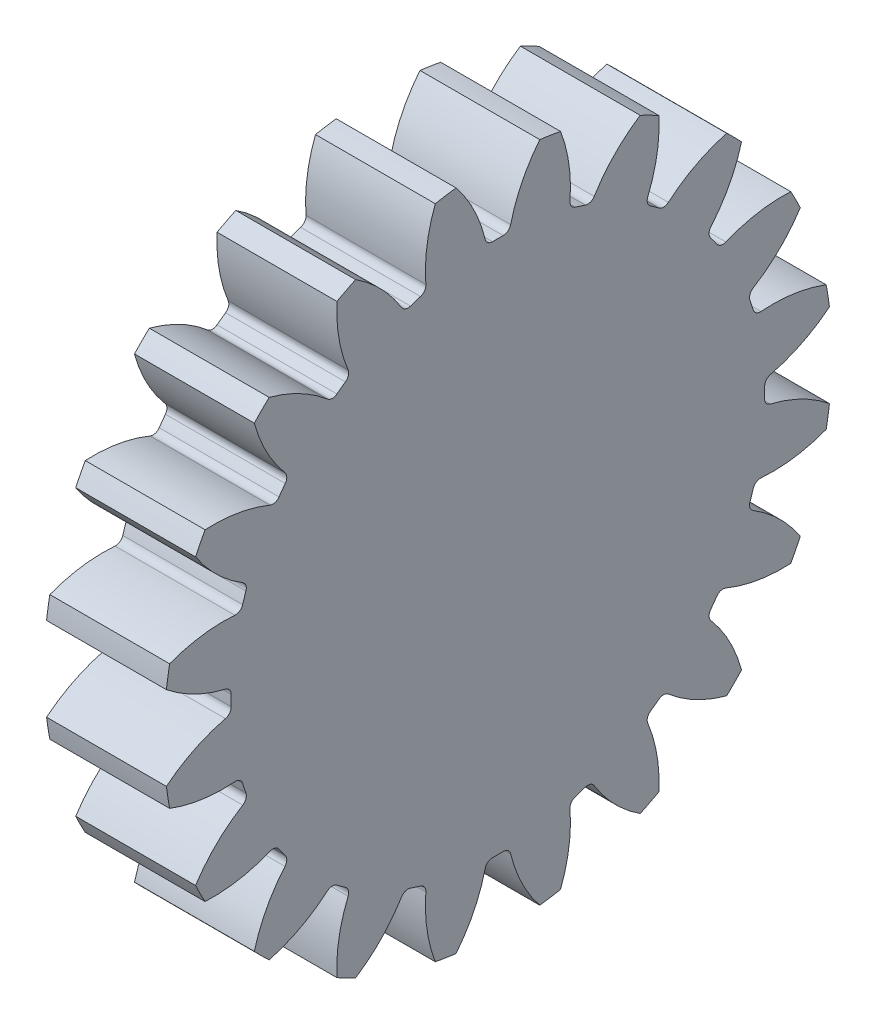
from build123d import *

# Parameters (mm, degrees)
BASPROSKE_W                     = 4
BASPROSKE_H                     = 11.154266119
TOOTHCUTRH_PITCH                = 397.467935473
TOOTHCUTRH_HEIGHT               = 4
TOOTHCUTRH_RADIUS               = 11.154266119
TOOTHCUTRH_START_ANGLE          = -90
TEETHCUTSRH_COUNT               = 20
TEETHCUTSRH_ANGLE               = 342
BORSKE_R                        = 3
BORE_DEPTH                      = 62.5000025
SKIZZE1_R                       = 4.15
LOCH_DEPTH                      = 17.244020749
LASCHEN_RUND_DEPTH              = 1.7
LASCHE_GROSS_ECKIG_DEPTH        = 1.7
SCHNITT_LINEAR_AUSTRAGEN4_DEPTH = 1.7
SKIZZE7_R                       = 1
LOCH_OPTION_DEPTH               = 17.244021148
KREISMUSTER1_COUNT              = 6
BOSS_EXTRUDE1_DEPTH             = 4
SKETCH5_R                       = 18.56871855
CUT_EXTRUDE1_DEPTH              = 4


with BuildPart() as part:
    # BasProSke → Base-Revolve (revolve)
    with BuildSketch(Plane(origin=(0, 0, 0), x_dir=(1, 0, 0), z_dir=(0, 1, 0)), mode=Mode.PRIVATE) as base_revolve_sk:
        with Locations((2, 5.57713306)):
            Rectangle(BASPROSKE_W, BASPROSKE_H)
    revolve(base_revolve_sk.sketch.rotate(Axis((-10, 0, 0), (1, 0, 0)), 180), axis=Axis((-10, 0, 0), (1, 0, 0)))

    # ToothCutRH: sweep along a helix
    with BuildLine() as toothcutrh_path:
        add(Helix(TOOTHCUTRH_PITCH, TOOTHCUTRH_HEIGHT, TOOTHCUTRH_RADIUS, center=(0, 0, 0), direction=(1, 0, 0), mode=Mode.PRIVATE).rotate(Axis((0, 0, 0), (1, 0, 0)), TOOTHCUTRH_START_ANGLE))
    # TooCutSkeRH → ToothCutRH (sweep, cut)
    with BuildSketch(Plane(origin=(0, 0, 0), x_dir=(0, 0, -1), z_dir=(1, 0, 0))):
        with BuildLine():
            ThreePointArc((0.176132075, 8.902523946), (0, 8.904266119), (-0.176132075, 8.902523946))
            ThreePointArc((-0.176132075, 8.902523946), (-0.334445137, 8.954765617), (-0.425110314, 9.094665737))
            ThreePointArc((-0.425110314, 9.094665737), (-0.893917111, 10.312771472), (-1.662006655, 11.368043876))
            ThreePointArc((-1.662006655, 11.368043876), (0, 11.488894102), (1.662006655, 11.368043876))
            ThreePointArc((1.662006655, 11.368043876), (0.893917111, 10.312771472), (0.425110314, 9.094665737))
            ThreePointArc((0.425110314, 9.094665737), (0.334445137, 8.954765617), (0.176132075, 8.902523946))
        make_face()
    toothcutrh = sweep(path=toothcutrh_path.line, is_frenet=True, mode=Mode.SUBTRACT)

    # TeethCutsRH: ToothCutRH ×20 about axis
    teethcutsrh_axis = Axis((-10, 0, 0), (1, 0, 0))
    for i in range(1, TEETHCUTSRH_COUNT):
        add(toothcutrh.rotate(teethcutsrh_axis, i * TEETHCUTSRH_ANGLE / (TEETHCUTSRH_COUNT - 1)), mode=Mode.SUBTRACT)

    # BorSke → Bore (cut, symmetric)
    with BuildSketch(Plane(origin=(0, 0, 0), x_dir=(0, 0, -1), z_dir=(1, 0, 0))):
        with Locations(Location((0, 0, 0), (0, 0, 180))):
            Circle(BORSKE_R)
    extrude(amount=BORE_DEPTH, both=True, mode=Mode.SUBTRACT)

    # Skizze1 → loch (cut, through all)
    with BuildSketch(Plane(origin=(4, 0, 0), x_dir=(0, 0, -1), z_dir=(1, 0, 0))):
        Circle(SKIZZE1_R)
    extrude(amount=-LOCH_DEPTH, mode=Mode.SUBTRACT)

    # Skizze2 → laschen rund (cut)
    with BuildSketch(Plane(origin=(4, 0, 0), x_dir=(0, 0, -1), z_dir=(1, 0, 0))):
        with BuildLine():
            Line((-6.4, 2.15), (6.4, 2.15))
            ThreePointArc((6.4, 2.15), (8.55, 0), (6.4, -2.15))
            Line((6.4, -2.15), (-6.4, -2.15))
            ThreePointArc((-6.4, -2.15), (-8.55, 0), (-6.4, 2.15))
        make_face()
    extrude(amount=-LASCHEN_RUND_DEPTH, mode=Mode.SUBTRACT)

    # Skizze5 → lasche gross eckig (cut)
    with BuildSketch(Plane(origin=(4, 0, 0), x_dir=(0, 0, -1), z_dir=(1, 0, 0))):
        Polygon((-3.125502306, 7.65), (-3.6, 2.15), (3.6, 2.15), (3.125502306, 7.65), align=None)
    extrude(amount=-LASCHE_GROSS_ECKIG_DEPTH, mode=Mode.SUBTRACT)

    # Skizze6 → Schnitt-Linear austragen4 (cut)
    with BuildSketch(Plane(origin=(4, 0, 0), x_dir=(0, 0, -1), z_dir=(1, 0, 0))):
        Polygon((-3.144670941, -2.194021559), (-2.740477844, -7.332363985), (2.804249033, -7.332363985), (3.255322421, -2.203238944), align=None)
    extrude(amount=-SCHNITT_LINEAR_AUSTRAGEN4_DEPTH, mode=Mode.SUBTRACT)

    # Skizze7 → loch option (cut, through all)
    with BuildSketch(Plane.ZY):
        with Locations((1.333158904, -6.48479628)):
            Circle(SKIZZE7_R)
    loch_option = extrude(amount=-LOCH_OPTION_DEPTH, mode=Mode.SUBTRACT)

    # Kreismuster1: loch option ×6 about axis
    kreismuster1_axis = Axis((0, 0, 0), (1, 0, 0))
    for i in range(1, KREISMUSTER1_COUNT):
        add(loch_option.rotate(kreismuster1_axis, i * 360 / KREISMUSTER1_COUNT), mode=Mode.SUBTRACT)

    # Sketch4 → Boss-Extrude1 (add)
    with BuildSketch(Plane.ZY):
        with BuildLine():
            ThreePointArc((-1.397458918, 11.06637977), (-1.744911653, 11.016938593), (-2.090637005, 10.956591147))
            ThreePointArc((-2.090637005, 10.956591147), (-2.369428009, 9.886302254), (-2.406102336, 8.780907424))
            ThreePointArc((-2.406102336, 8.780907424), (-2.44909853, 8.619837423), (-2.583519634, 8.521231215))
            ThreePointArc((-2.583519634, 8.521231215), (-2.751569553, 8.468460315), (-2.91854275, 8.412375606))
            ThreePointArc((-2.91854275, 8.412375606), (-3.085250983, 8.413138961), (-3.214710205, 8.518174801))
            ThreePointArc((-3.214710205, 8.518174801), (-3.894115139, 9.390901375), (-4.748761826, 10.092914038))
            ThreePointArc((-4.748761826, 10.092914038), (-5.06393085, 9.938523884), (-5.374086811, 9.774295043))
            ThreePointArc((-5.374086811, 9.774295043), (-5.308495356, 8.670238659), (-5.001788926, 7.607612712))
            ThreePointArc((-5.001788926, 7.607612712), (-4.992907368, 7.441139484), (-5.090278441, 7.305821001))
            ThreePointArc((-5.090278441, 7.305821001), (-5.233796307, 7.203702613), (-5.375266126, 7.098765329))
            ThreePointArc((-5.375266126, 7.098765329), (-5.534050967, 7.047975646), (-5.689631863, 7.107865566))
            ThreePointArc((-5.689631863, 7.107865566), (-6.605471695, 7.727930191), (-7.635222839, 8.131483558))
            ThreePointArc((-7.635222839, 8.131483558), (-7.887257212, 7.887257212), (-8.131483558, 7.635222839))
            ThreePointArc((-8.131483558, 7.635222839), (-7.727930191, 6.605471695), (-7.107865566, 5.689631863))
            ThreePointArc((-7.107865566, 5.689631863), (-7.047975646, 5.534050967), (-7.098765329, 5.375266126))
            ThreePointArc((-7.098765329, 5.375266126), (-7.203702613, 5.233796307), (-7.305821001, 5.090278441))
            ThreePointArc((-7.305821001, 5.090278441), (-7.441139484, 4.992907368), (-7.607612712, 5.001788926))
            ThreePointArc((-7.607612712, 5.001788926), (-8.670238659, 5.308495356), (-9.774295043, 5.374086811))
            ThreePointArc((-9.774295043, 5.374086811), (-9.938523884, 5.06393085), (-10.092914038, 4.748761826))
            ThreePointArc((-10.092914038, 4.748761826), (-9.390901375, 3.894115139), (-8.518174801, 3.214710205))
            ThreePointArc((-8.518174801, 3.214710205), (-8.413138961, 3.085250983), (-8.412375606, 2.91854275))
            ThreePointArc((-8.412375606, 2.91854275), (-8.468460315, 2.751569553), (-8.521231215, 2.583519634))
            ThreePointArc((-8.521231215, 2.583519634), (-8.619837423, 2.44909853), (-8.780907424, 2.406102336))
            ThreePointArc((-8.780907424, 2.406102336), (-9.886302254, 2.369428009), (-10.956591147, 2.090637005))
            ThreePointArc((-10.956591147, 2.090637005), (-11.016938593, 1.744911653), (-11.06637977, 1.397458918))
            ThreePointArc((-11.06637977, 1.397458918), (-10.134625703, 0.801575461), (-9.094665737, 0.425110314))
            ThreePointArc((-9.094665737, 0.425110314), (-8.954765617, 0.334445137), (-8.902523946, 0.176132075))
            ThreePointArc((-8.902523946, 0.176132075), (-8.904266119, 0), (-8.902523946, -0.176132075))
            ThreePointArc((-8.902523946, -0.176132075), (-8.954765617, -0.334445137), (-9.094665737, -0.425110314))
            ThreePointArc((-9.094665737, -0.425110314), (-10.134625703, -0.801575461), (-11.06637977, -1.397458918))
            ThreePointArc((-11.06637977, -1.397458918), (-11.016938593, -1.744911653), (-10.956591147, -2.090637005))
            ThreePointArc((-10.956591147, -2.090637005), (-9.886302254, -2.369428009), (-8.780907424, -2.406102336))
            ThreePointArc((-8.780907424, -2.406102336), (-8.619837423, -2.44909853), (-8.521231215, -2.583519634))
            ThreePointArc((-8.521231215, -2.583519634), (-8.468460315, -2.751569553), (-8.412375606, -2.91854275))
            ThreePointArc((-8.412375606, -2.91854275), (-8.413138961, -3.085250983), (-8.518174801, -3.214710205))
            ThreePointArc((-8.518174801, -3.214710205), (-9.390901375, -3.894115139), (-10.092914038, -4.748761826))
            ThreePointArc((-10.092914038, -4.748761826), (-9.938523884, -5.06393085), (-9.774295043, -5.374086811))
            ThreePointArc((-9.774295043, -5.374086811), (-8.670238659, -5.308495356), (-7.607612712, -5.001788926))
            ThreePointArc((-7.607612712, -5.001788926), (-7.441139484, -4.992907368), (-7.305821001, -5.090278441))
            ThreePointArc((-7.305821001, -5.090278441), (-7.203702613, -5.233796307), (-7.098765329, -5.375266126))
            ThreePointArc((-7.098765329, -5.375266126), (-7.047975646, -5.534050967), (-7.107865566, -5.689631863))
            ThreePointArc((-7.107865566, -5.689631863), (-7.727930191, -6.605471695), (-8.131483558, -7.635222839))
            ThreePointArc((-8.131483558, -7.635222839), (-7.887257212, -7.887257212), (-7.635222839, -8.131483558))
            ThreePointArc((-7.635222839, -8.131483558), (-6.605471695, -7.727930191), (-5.689631863, -7.107865566))
            ThreePointArc((-5.689631863, -7.107865566), (-5.534050967, -7.047975646), (-5.375266126, -7.098765329))
            ThreePointArc((-5.375266126, -7.098765329), (-5.233796307, -7.203702613), (-5.090278441, -7.305821001))
            ThreePointArc((-5.090278441, -7.305821001), (-4.992907368, -7.441139484), (-5.001788926, -7.607612712))
            ThreePointArc((-5.001788926, -7.607612712), (-5.308495356, -8.670238659), (-5.374086811, -9.774295043))
            ThreePointArc((-5.374086811, -9.774295043), (-5.06393085, -9.938523884), (-4.748761826, -10.092914038))
            ThreePointArc((-4.748761826, -10.092914038), (-3.894115139, -9.390901375), (-3.214710205, -8.518174801))
            ThreePointArc((-3.214710205, -8.518174801), (-3.085250983, -8.413138961), (-2.91854275, -8.412375606))
            ThreePointArc((-2.91854275, -8.412375606), (-2.751569553, -8.468460315), (-2.583519634, -8.521231215))
            ThreePointArc((-2.583519634, -8.521231215), (-2.44909853, -8.619837423), (-2.406102336, -8.780907424))
            ThreePointArc((-2.406102336, -8.780907424), (-2.369428009, -9.886302254), (-2.090637005, -10.956591147))
            ThreePointArc((-2.090637005, -10.956591147), (-1.744911653, -11.016938593), (-1.397458918, -11.06637977))
            ThreePointArc((-1.397458918, -11.06637977), (-0.801575461, -10.134625703), (-0.425110314, -9.094665737))
            ThreePointArc((-0.425110314, -9.094665737), (-0.334445137, -8.954765617), (-0.176132075, -8.902523946))
            ThreePointArc((-0.176132075, -8.902523946), (0, -8.904266119), (0.176132075, -8.902523946))
            ThreePointArc((0.176132075, -8.902523946), (0.334445137, -8.954765617), (0.425110314, -9.094665737))
            ThreePointArc((0.425110314, -9.094665737), (0.801575461, -10.134625703), (1.397458918, -11.06637977))
            ThreePointArc((1.397458918, -11.06637977), (1.744911653, -11.016938593), (2.090637005, -10.956591147))
            ThreePointArc((2.090637005, -10.956591147), (2.369428009, -9.886302254), (2.406102336, -8.780907424))
            ThreePointArc((2.406102336, -8.780907424), (2.44909853, -8.619837423), (2.583519634, -8.521231215))
            ThreePointArc((2.583519634, -8.521231215), (2.751569553, -8.468460315), (2.91854275, -8.412375606))
            ThreePointArc((2.91854275, -8.412375606), (3.085250983, -8.413138961), (3.214710205, -8.518174801))
            ThreePointArc((3.214710205, -8.518174801), (3.894115139, -9.390901375), (4.748761826, -10.092914038))
            ThreePointArc((4.748761826, -10.092914038), (5.06393085, -9.938523884), (5.374086811, -9.774295043))
            ThreePointArc((5.374086811, -9.774295043), (5.308495356, -8.670238659), (5.001788926, -7.607612712))
            ThreePointArc((5.001788926, -7.607612712), (4.992907368, -7.441139484), (5.090278441, -7.305821001))
            ThreePointArc((5.090278441, -7.305821001), (5.233796307, -7.203702613), (5.375266126, -7.098765329))
            ThreePointArc((5.375266126, -7.098765329), (5.534050967, -7.047975646), (5.689631863, -7.107865566))
            ThreePointArc((5.689631863, -7.107865566), (6.605471695, -7.727930191), (7.635222839, -8.131483558))
            ThreePointArc((7.635222839, -8.131483558), (7.887257212, -7.887257212), (8.131483558, -7.635222839))
            ThreePointArc((8.131483558, -7.635222839), (7.727930191, -6.605471695), (7.107865566, -5.689631863))
            ThreePointArc((7.107865566, -5.689631863), (7.047975646, -5.534050967), (7.098765329, -5.375266126))
            ThreePointArc((7.098765329, -5.375266126), (7.203702613, -5.233796307), (7.305821001, -5.090278441))
            ThreePointArc((7.305821001, -5.090278441), (7.441139484, -4.992907368), (7.607612712, -5.001788926))
            ThreePointArc((7.607612712, -5.001788926), (8.670238659, -5.308495356), (9.774295043, -5.374086811))
            ThreePointArc((9.774295043, -5.374086811), (9.938523884, -5.06393085), (10.092914038, -4.748761826))
            ThreePointArc((10.092914038, -4.748761826), (9.390901375, -3.894115139), (8.518174801, -3.214710205))
            ThreePointArc((8.518174801, -3.214710205), (8.413138961, -3.085250983), (8.412375606, -2.91854275))
            ThreePointArc((8.412375606, -2.91854275), (8.468460315, -2.751569553), (8.521231215, -2.583519634))
            ThreePointArc((8.521231215, -2.583519634), (8.619837423, -2.44909853), (8.780907424, -2.406102336))
            ThreePointArc((8.780907424, -2.406102336), (9.886302254, -2.369428009), (10.956591147, -2.090637005))
            ThreePointArc((10.956591147, -2.090637005), (11.016938593, -1.744911653), (11.06637977, -1.397458918))
            ThreePointArc((11.06637977, -1.397458918), (10.134625703, -0.801575461), (9.094665737, -0.425110314))
            ThreePointArc((9.094665737, -0.425110314), (8.954765617, -0.334445137), (8.902523946, -0.176132075))
            ThreePointArc((8.902523946, -0.176132075), (8.904266119, 0), (8.902523946, 0.176132075))
            ThreePointArc((8.902523946, 0.176132075), (8.954765617, 0.334445137), (9.094665737, 0.425110314))
            ThreePointArc((9.094665737, 0.425110314), (10.134625703, 0.801575461), (11.06637977, 1.397458918))
            ThreePointArc((11.06637977, 1.397458918), (11.016938593, 1.744911653), (10.956591147, 2.090637005))
            ThreePointArc((10.956591147, 2.090637005), (9.886302254, 2.369428009), (8.780907424, 2.406102336))
            ThreePointArc((8.780907424, 2.406102336), (8.619837423, 2.44909853), (8.521231215, 2.583519634))
            ThreePointArc((8.521231215, 2.583519634), (8.468460315, 2.751569553), (8.412375606, 2.91854275))
            ThreePointArc((8.412375606, 2.91854275), (8.413138961, 3.085250983), (8.518174801, 3.214710205))
            ThreePointArc((8.518174801, 3.214710205), (9.390901375, 3.894115139), (10.092914038, 4.748761826))
            ThreePointArc((10.092914038, 4.748761826), (9.938523884, 5.06393085), (9.774295043, 5.374086811))
            ThreePointArc((9.774295043, 5.374086811), (8.670238659, 5.308495356), (7.607612712, 5.001788926))
            ThreePointArc((7.607612712, 5.001788926), (7.441139484, 4.992907368), (7.305821001, 5.090278441))
            ThreePointArc((7.305821001, 5.090278441), (7.203702613, 5.233796307), (7.098765329, 5.375266126))
            ThreePointArc((7.098765329, 5.375266126), (7.047975646, 5.534050967), (7.107865566, 5.689631863))
            ThreePointArc((7.107865566, 5.689631863), (7.727930191, 6.605471695), (8.131483558, 7.635222839))
            ThreePointArc((8.131483558, 7.635222839), (7.887257212, 7.887257212), (7.635222839, 8.131483558))
            ThreePointArc((7.635222839, 8.131483558), (6.605471695, 7.727930191), (5.689631863, 7.107865566))
            ThreePointArc((5.689631863, 7.107865566), (5.534050967, 7.047975646), (5.375266126, 7.098765329))
            ThreePointArc((5.375266126, 7.098765329), (5.233796307, 7.203702613), (5.090278441, 7.305821001))
            ThreePointArc((5.090278441, 7.305821001), (4.992907368, 7.441139484), (5.001788926, 7.607612712))
            ThreePointArc((5.001788926, 7.607612712), (5.308495356, 8.670238659), (5.374086811, 9.774295043))
            ThreePointArc((5.374086811, 9.774295043), (5.06393085, 9.938523884), (4.748761826, 10.092914038))
            ThreePointArc((4.748761826, 10.092914038), (3.894115139, 9.390901375), (3.214710205, 8.518174801))
            ThreePointArc((3.214710205, 8.518174801), (3.085250983, 8.413138961), (2.91854275, 8.412375606))
            ThreePointArc((2.91854275, 8.412375606), (2.751569553, 8.468460315), (2.583519634, 8.521231215))
            ThreePointArc((2.583519634, 8.521231215), (2.44909853, 8.619837423), (2.406102336, 8.780907424))
            ThreePointArc((2.406102336, 8.780907424), (2.369428009, 9.886302254), (2.090637005, 10.956591147))
            ThreePointArc((2.090637005, 10.956591147), (1.744911653, 11.016938593), (1.397458918, 11.06637977))
            ThreePointArc((1.397458918, 11.06637977), (0.801575461, 10.134625703), (0.425110314, 9.094665737))
            ThreePointArc((0.425110314, 9.094665737), (0.334445137, 8.954765617), (0.176132075, 8.902523946))
            ThreePointArc((0.176132075, 8.902523946), (0, 8.904266119), (-0.176132075, 8.902523946))
            ThreePointArc((-0.176132075, 8.902523946), (-0.334445137, 8.954765617), (-0.425110314, 9.094665737))
            ThreePointArc((-0.425110314, 9.094665737), (-0.801575461, 10.134625703), (-1.397458918, 11.06637977))
        make_face()
    extrude(amount=BOSS_EXTRUDE1_DEPTH)

    # Sketch5 → Cut-Extrude1 (cut)
    with BuildSketch(Plane(origin=(0, 0, 0), x_dir=(0, 0, -1), z_dir=(1, 0, 0))):
        Circle(SKETCH5_R)
    extrude(amount=CUT_EXTRUDE1_DEPTH, mode=Mode.SUBTRACT)


solid = part.part
